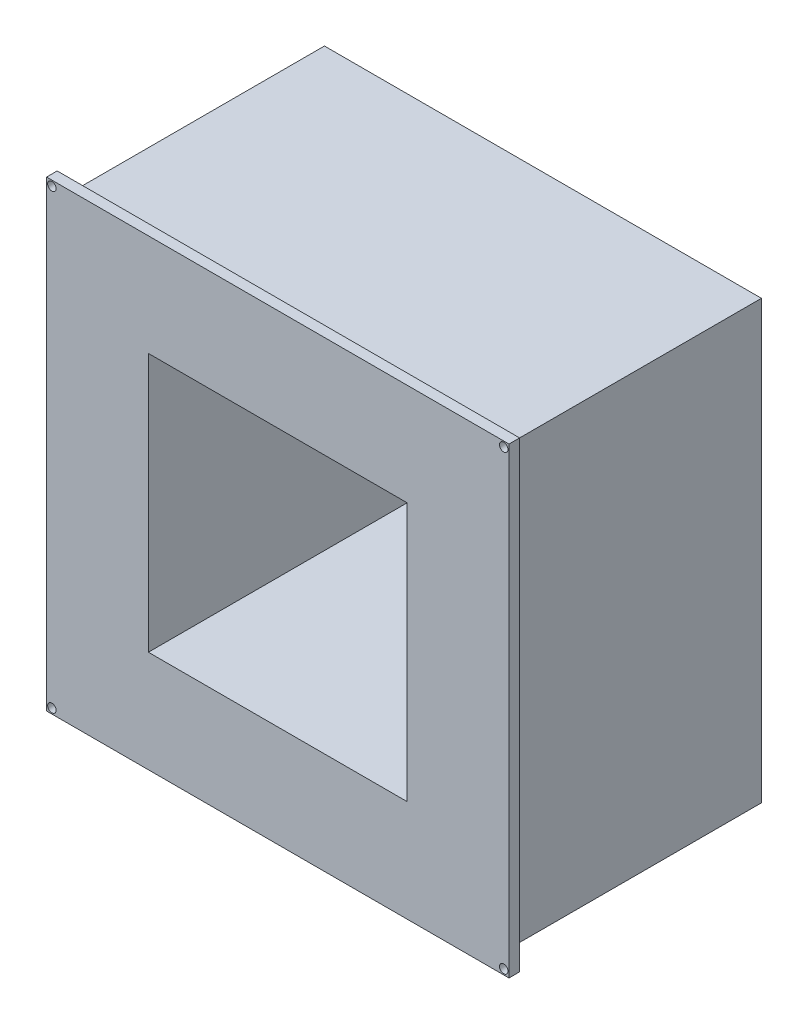
from build123d import *

# Parameters (mm, degrees)
SKETCH1_W           = 206
SKETCH1_H           = 206
SKETCH1_W_2         = 200
SKETCH1_H_2         = 200
EXTRUDE_THIN1_DEPTH = 120
SKETCH3_W           = 200
SKETCH3_H           = 200
SKETCH3_W_2         = 122
SKETCH3_H_2         = 122
EXTRUDE_THIN2_DEPTH = 120
SKETCH5_W           = 218
SKETCH5_H           = 218
BOSS_EXTRUDE2_DEPTH = 5
SKETCH3_4_W         = 122
SKETCH3_4_H         = 122
CUT_EXTRUDE5_DEPTH  = 364
SKETCH12_R          = 2
CUT_EXTRUDE6_DEPTH  = 10


with BuildPart() as part:
    # Sketch1 → Extrude-Thin1 (new body)
    with BuildSketch(Plane.XY):
        Rectangle(SKETCH1_W, SKETCH1_H)
        Rectangle(SKETCH1_W_2, SKETCH1_H_2, mode=Mode.SUBTRACT)
    extrude(amount=EXTRUDE_THIN1_DEPTH)

    # Sketch3 → Extrude-Thin2 (add)
    with BuildSketch(Plane.XY):
        Rectangle(SKETCH3_W, SKETCH3_H)
        Rectangle(SKETCH3_W_2, SKETCH3_H_2, mode=Mode.SUBTRACT)
    extrude(amount=EXTRUDE_THIN2_DEPTH)

    # Sketch5 → Boss-Extrude2 (add)
    with BuildSketch(Plane.XY.offset(120)):
        Rectangle(SKETCH5_W, SKETCH5_H)
    extrude(amount=BOSS_EXTRUDE2_DEPTH)

    # Sketch3<4> → Cut-Extrude5 (cut)
    with BuildSketch(Plane.XY):
        Rectangle(SKETCH3_4_W, SKETCH3_4_H)
    extrude(amount=CUT_EXTRUDE5_DEPTH, mode=Mode.SUBTRACT)

    # Sketch12 → Cut-Extrude6 (cut)
    with BuildSketch(Plane.XY.offset(125)):
        with Locations((-106.5, 106.5)):
            Circle(SKETCH12_R)
        with Locations((106.5, 106.5)):
            Circle(SKETCH12_R)
        with Locations((106.5, -106.5)):
            Circle(SKETCH12_R)
        with Locations((-106.5, -106.5)):
            Circle(SKETCH12_R)
    extrude(amount=-CUT_EXTRUDE6_DEPTH, mode=Mode.SUBTRACT)


solid = part.part
